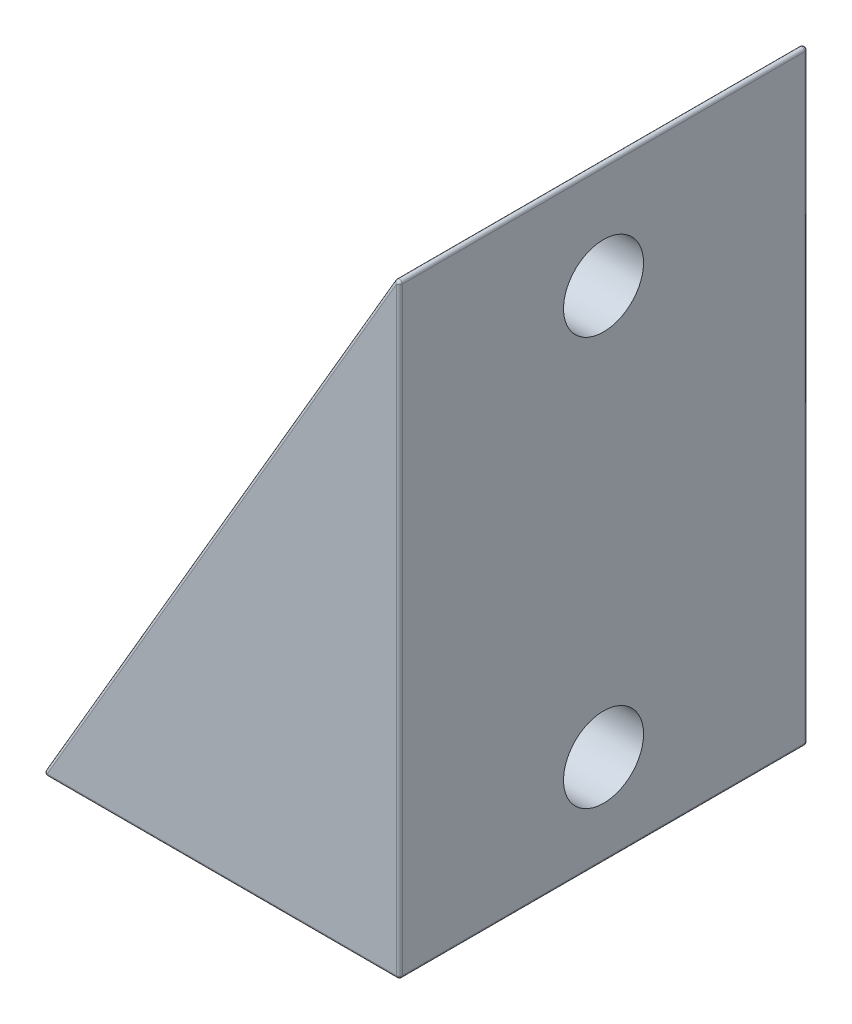
from build123d import *

# Parameters (mm, degrees)
BOSS_EXTRUDE1_DEPTH = 25.4
FILLET1_R           = 0.1778
SKETCH2_R           = 2.4892
CUT_EXTRUDE1_DEPTH  = 50.8


with BuildPart() as part:
    # Sketch1 → Boss-Extrude1 (new body)
    with BuildSketch(Plane.XY):
        Polygon((0, 0), (0, 38.1), (-22.225, 0), align=None)
    extrude(amount=BOSS_EXTRUDE1_DEPTH)

    # Fillet1
    fillet1_edges = [part.edges().sort_by_distance(p)[0] for p in [
        (-11.1125, 0, 0),
        (0, 19.05, 0),
        (-11.1125, 19.05, 0),
        (-11.1125, 0, 25.4),
        (-11.1125, 19.05, 25.4),
        (-22.225, 0, 12.7),
        (0, 38.1, 12.7),
        (0, 0, 12.7),
        (0, 19.05, 25.4),
    ]]
    fillet(fillet1_edges, radius=FILLET1_R)

    # Sketch2 → Cut-Extrude1 (cut)
    with BuildSketch(Plane(origin=(0, 0, 0), x_dir=(0, 0, -1), z_dir=(1, 0, 0))):
        with Locations((-12.7, 31.092331923)):
            Circle(SKETCH2_R)
        with Locations((-12.7, 5.692331923)):
            Circle(SKETCH2_R)
    extrude(amount=-CUT_EXTRUDE1_DEPTH, mode=Mode.SUBTRACT)


solid = part.part
